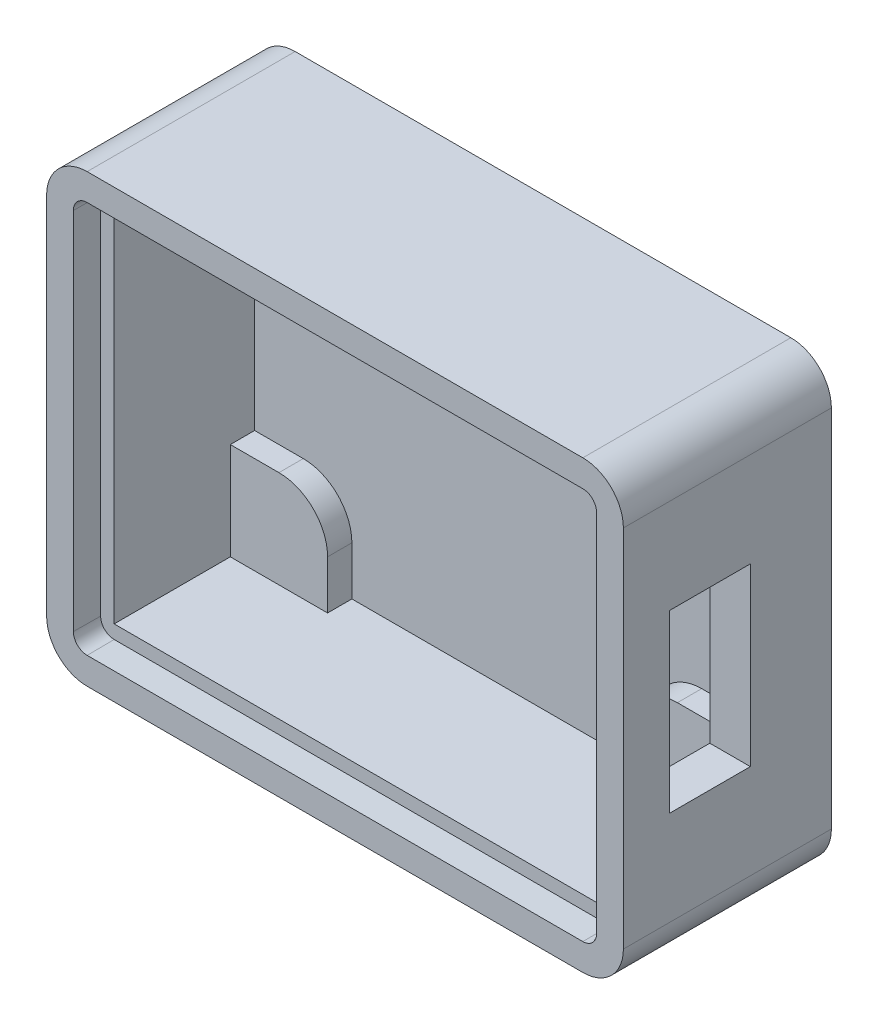
from build123d import *

# Parameters (mm, degrees)
SKETCH1_W           = 27
SKETCH1_H           = 36.7
BOSS_EXTRUDE1_DEPTH = 10.4
SHELL1_T            = 3
BOSS_EXTRUDE2_DEPTH = 1.8
CUT_EXTRUDE1_REACH  = 48.944
SKETCH3_W           = 13
SKETCH3_H           = 6
FILLET1_R           = 3
LIP2_START          = 10.4
LIP2_DEPTH          = 2


with BuildPart() as part:
    # Sketch1 → Boss-Extrude1 (new body)
    with BuildSketch(Plane(origin=(0, 0, 0), x_dir=(0, 1, 0), z_dir=(0, 0, 1))):
        Rectangle(SKETCH1_W, SKETCH1_H)
    extrude(amount=BOSS_EXTRUDE1_DEPTH)

    # Shell1
    shell1_openings = [part.faces().sort_by_distance(p)[0] for p in [
        (0, 0, 10.4),
    ]]
    offset(amount=SHELL1_T, openings=shell1_openings, kind=Kind.INTERSECTION)

    # Sketch2 → Boss-Extrude2 (add)
    with BuildSketch(Plane.XY):
        with BuildLine():
            Line((-11.15, 9.9), (-11.15, 13.5))
            Line((-11.15, 13.5), (-18.35, 13.5))
            Line((-18.35, 13.5), (-18.35, 6.3))
            Line((-18.35, 6.3), (-14.75, 6.3))
            ThreePointArc((-14.75, 6.3), (-12.204415588, 7.354415588), (-11.15, 9.9))
        make_face()
        with BuildLine():
            Line((18.35, 13.5), (11.15, 13.5))
            Line((11.15, 13.5), (11.15, 9.9))
            ThreePointArc((11.15, 9.9), (12.204415588, 7.354415588), (14.75, 6.3))
            Line((14.75, 6.3), (18.35, 6.3))
            Line((18.35, 6.3), (18.35, 13.5))
        make_face()
        with BuildLine():
            Line((18.35, -13.5), (18.35, -6.3))
            Line((18.35, -6.3), (14.75, -6.3))
            ThreePointArc((14.75, -6.3), (12.204415588, -7.354415588), (11.15, -9.9))
            Line((11.15, -9.9), (11.15, -13.5))
            Line((11.15, -13.5), (18.35, -13.5))
        make_face()
        with BuildLine():
            Line((-14.75, -6.3), (-18.35, -6.3))
            Line((-18.35, -6.3), (-18.35, -13.5))
            Line((-18.35, -13.5), (-11.15, -13.5))
            Line((-11.15, -13.5), (-11.15, -9.9))
            ThreePointArc((-11.15, -9.9), (-12.204415588, -7.354415588), (-14.75, -6.3))
        make_face()
    extrude(amount=BOSS_EXTRUDE2_DEPTH)

    # Sketch3 → Cut-Extrude1 (cut, up to next)
    with BuildSketch(Plane.YZ.offset(21.35), mode=Mode.PRIVATE) as cut_extrude1_sk1:
        with Locations((0, 6)):
            Rectangle(SKETCH3_W, SKETCH3_H)
    cut_extrude1_tool1 = extrude(cut_extrude1_sk1.sketch, amount=-CUT_EXTRUDE1_REACH, mode=Mode.PRIVATE) & part.part
    add(cut_extrude1_tool1.solids().sort_by_distance((21.35, 0, 6))[0], mode=Mode.SUBTRACT)

    # Fillet1
    fillet1_edges = [part.edges().sort_by_distance(p)[0] for p in [
        (21.35, 16.5, 3.7),
        (21.35, -16.5, 3.7),
        (-21.35, -16.5, 3.7),
        (-21.35, 16.5, 3.7),
    ]]
    fillet(fillet1_edges, radius=FILLET1_R)

    # Lip2: read off the stored shape, not the designer's step
    # Lip2 outline → Lip2 (add)
    with BuildSketch(Plane.XY.offset(LIP2_START)):
        with BuildLine():
            Line((18.35, 16.5), (-18.35, 16.5))
            ThreePointArc((-18.35, 16.5), (-20.471320344, 15.621320344), (-21.35, 13.5))
            Line((-21.35, 13.5), (-21.35, -13.5))
            ThreePointArc((-21.35, -13.5), (-20.471320344, -15.621320344), (-18.35, -16.5))
            Line((-18.35, -16.5), (18.35, -16.5))
            ThreePointArc((18.35, -16.5), (20.471320344, -15.621320344), (21.35, -13.5))
            Line((21.35, -13.5), (21.35, 13.5))
            ThreePointArc((21.35, 13.5), (20.471320344, 15.621320344), (18.35, 16.5))
        make_face()
    extrude(amount=LIP2_DEPTH)

    # Lip2 2: loft between two sections, ruled curve by curve
    lip2_2_from = [
        Edge.make_three_point_arc((18.35, -14.5, 10.4), (19.057106781, -14.207106781, 10.4), (19.35, -13.5, 10.4)),
        Edge.make_three_point_arc((-19.35, -13.5, 10.4), (-19.057106781, -14.207106781, 10.4), (-18.35, -14.5, 10.4)),
        Edge.make_three_point_arc((-18.35, 14.5, 10.4), (-19.057106781, 14.207106781, 10.4), (-19.35, 13.5, 10.4)),
        Edge.make_three_point_arc((19.35, 13.5, 10.4), (19.057106781, 14.207106781, 10.4), (18.35, 14.5, 10.4)),
        Edge.make_line((19.35, -13.5, 10.4), (19.35, 13.5, 10.4)),
        Edge.make_line((-18.35, -14.5, 10.4), (18.35, -14.5, 10.4)),
        Edge.make_line((-19.35, 13.5, 10.4), (-19.35, -13.5, 10.4)),
        Edge.make_line((18.35, 14.5, 10.4), (-18.35, 14.5, 10.4)),
    ]
    lip2_2_to = [
        Edge.make_three_point_arc((18.35, -14.517453736, 12.4), (19.069448436, -14.219448436, 12.4), (19.367453736, -13.5, 12.4)),
        Edge.make_three_point_arc((-19.367453736, -13.5, 12.4), (-19.069448436, -14.219448436, 12.4), (-18.35, -14.517453736, 12.4)),
        Edge.make_three_point_arc((-18.35, 14.517453736, 12.4), (-19.069448436, 14.219448436, 12.4), (-19.367453736, 13.5, 12.4)),
        Edge.make_three_point_arc((19.367453736, 13.5, 12.4), (19.069448436, 14.219448436, 12.4), (18.35, 14.517453736, 12.4)),
        Edge.make_line((19.367453736, -13.5, 12.4), (19.367453736, 13.5, 12.4)),
        Edge.make_line((-18.35, -14.517453736, 12.4), (18.35, -14.517453736, 12.4)),
        Edge.make_line((-19.367453736, 13.5, 12.4), (-19.367453736, -13.5, 12.4)),
        Edge.make_line((18.35, 14.517453736, 12.4), (-18.35, 14.517453736, 12.4)),
    ]
    lip2_2 = Solid(Shell([*[Face.make_surface_from_curves(lip2_2_from[k], lip2_2_to[k]) for k in range(8)], Face(Wire(lip2_2_from)), Face(Wire(lip2_2_to))]))
    add(lip2_2, mode=Mode.SUBTRACT)


solid = part.part
